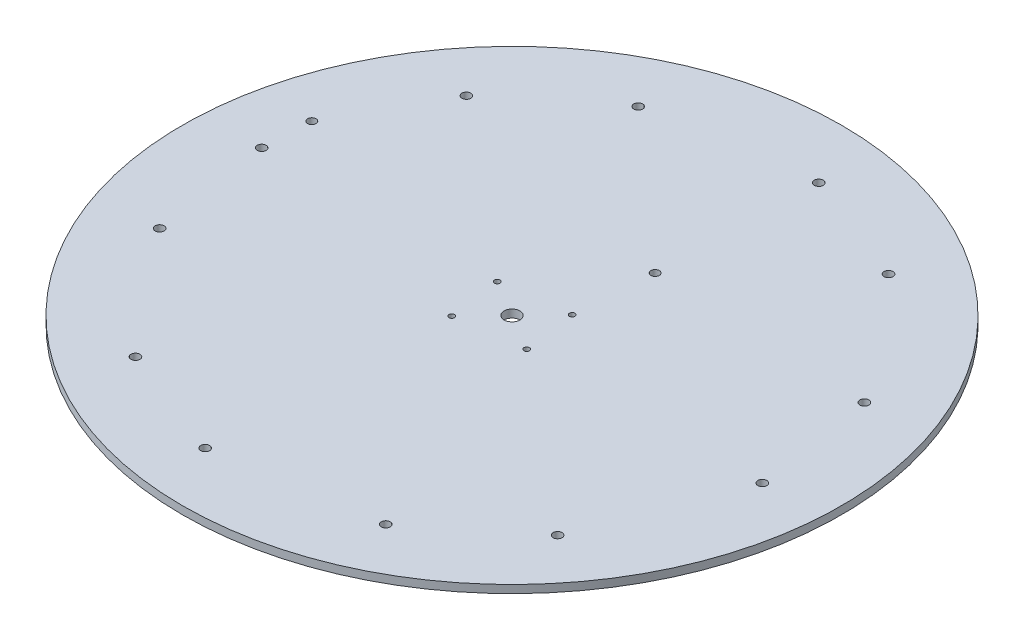
from build123d import *

# Parameters (mm, degrees)
SKETCH2_R               = 125
BOSS_EXTRUDE1_DEPTH     = 3
CUT_EXTRUDE1_START      = -26
SKETCH3_R               = 1.7
CUT_EXTRUDE1_DEPTH      = 88
CUT_EXTRUDE2_DEPTH      = 55
CUT_EXTRUDE2_DEPTH_BACK = 33
SKETCH4_R               = 3
SKETCH5_R               = 1.6
CUT_EXTRUDE3_DEPTH      = 177.802149308
CUT_EXTRUDE4_REACH      = 178.802
SKETCH6_R               = 1.05
CIRPATTERN1_COUNT       = 6


with BuildPart() as part:
    # Sketch2 → Boss-Extrude1 (new body)
    with BuildSketch(Plane(origin=(0, 0, 0), x_dir=(1, 0, 0), z_dir=(0, 1, 0))):
        Circle(SKETCH2_R)
    extrude(amount=BOSS_EXTRUDE1_DEPTH)

    # Sketch3 → Cut-Extrude1 (cut)
    with BuildSketch(Plane(origin=(0, 3, 0), x_dir=(1, 0, 0), z_dir=(0, 1, 0)).offset(CUT_EXTRUDE1_START)):
        with Locations((57.824361976, 84.994428132)):
            Circle(SKETCH3_R)
        with Locations((14.606066285, 101.75643704)):
            Circle(SKETCH3_R)
        with Locations((44.695152955, -92.574580495)):
            Circle(SKETCH3_R)
        with Locations((80.820626333, -63.527442972)):
            Circle(SKETCH3_R)
        with Locations((-102.519514931, 7.580152362)):
            Circle(SKETCH3_R)
        with Locations((-95.426692618, -38.228994068)):
            Circle(SKETCH3_R)
    cut_extrude1 = extrude(amount=CUT_EXTRUDE1_DEPTH, mode=Mode.SUBTRACT)

    # Sketch4 → Cut-Extrude2 (cut, two sides: drawn at the far end of the back side and taken through both)
    with BuildSketch(Plane(origin=(0, 3, 0), x_dir=(1, 0, 0), z_dir=(0, 1, 0)).offset(-CUT_EXTRUDE2_DEPTH_BACK)):
        Circle(SKETCH4_R)
    extrude(amount=CUT_EXTRUDE2_DEPTH + CUT_EXTRUDE2_DEPTH_BACK, mode=Mode.SUBTRACT)

    # Sketch5 → Cut-Extrude3 (cut, through all)
    with BuildSketch(Plane.XZ):
        with Locations((-101.778099897, -25.854755487)):
            Circle(SKETCH5_R)
        with Locations((13.216774043, -41.092175458)):
            Circle(SKETCH5_R)
    extrude(amount=-CUT_EXTRUDE3_DEPTH, mode=Mode.SUBTRACT)

    # Sketch6 → Cut-Extrude4 (cut, up to next)
    with BuildSketch(Plane(origin=(0, 3, 0), x_dir=(1, 0, 0), z_dir=(0, 1, 0)), mode=Mode.PRIVATE) as cut_extrude4_sk1:
        with Locations((11.198414604, 11.625148557)):
            Circle(SKETCH6_R)
    cut_extrude4_tool1 = extrude(cut_extrude4_sk1.sketch, amount=-CUT_EXTRUDE4_REACH, mode=Mode.PRIVATE) & part.part
    # Sketch6 → Cut-Extrude4 (cut, up to next)
    with BuildSketch(Plane(origin=(0, 3, 0), x_dir=(1, 0, 0), z_dir=(0, 1, 0)), mode=Mode.PRIVATE) as cut_extrude4_sk2:
        with Locations((13.889158795, -8.300914364)):
            Circle(SKETCH6_R)
    cut_extrude4_tool2 = extrude(cut_extrude4_sk2.sketch, amount=-CUT_EXTRUDE4_REACH, mode=Mode.PRIVATE) & part.part
    # Sketch6 → Cut-Extrude4 (cut, up to next)
    with BuildSketch(Plane(origin=(0, 3, 0), x_dir=(1, 0, 0), z_dir=(0, 1, 0)), mode=Mode.PRIVATE) as cut_extrude4_sk3:
        with Locations((-11.198414604, -11.625148557)):
            Circle(SKETCH6_R)
    cut_extrude4_tool3 = extrude(cut_extrude4_sk3.sketch, amount=-CUT_EXTRUDE4_REACH, mode=Mode.PRIVATE) & part.part
    # Sketch6 → Cut-Extrude4 (cut, up to next)
    with BuildSketch(Plane(origin=(0, 3, 0), x_dir=(1, 0, 0), z_dir=(0, 1, 0)), mode=Mode.PRIVATE) as cut_extrude4_sk4:
        with Locations((-13.889158795, 8.300914364)):
            Circle(SKETCH6_R)
    cut_extrude4_tool4 = extrude(cut_extrude4_sk4.sketch, amount=-CUT_EXTRUDE4_REACH, mode=Mode.PRIVATE) & part.part
    add(cut_extrude4_tool1.solids().sort_by_distance((11.198415, 3, -11.625149))[0], mode=Mode.SUBTRACT)
    add(cut_extrude4_tool2.solids().sort_by_distance((13.889159, 3, 8.300914))[0], mode=Mode.SUBTRACT)
    add(cut_extrude4_tool3.solids().sort_by_distance((-11.198415, 3, 11.625149))[0], mode=Mode.SUBTRACT)
    add(cut_extrude4_tool4.solids().sort_by_distance((-13.889159, 3, -8.300914))[0], mode=Mode.SUBTRACT)

    # CirPattern1: Cut-Extrude1 ×6 about axis
    cirpattern1_axis = Axis((0, 3, 0), (0, 1, 0))
    for i in range(1, CIRPATTERN1_COUNT):
        add(cut_extrude1.rotate(cirpattern1_axis, i * 360 / CIRPATTERN1_COUNT), mode=Mode.SUBTRACT)


solid = part.part
